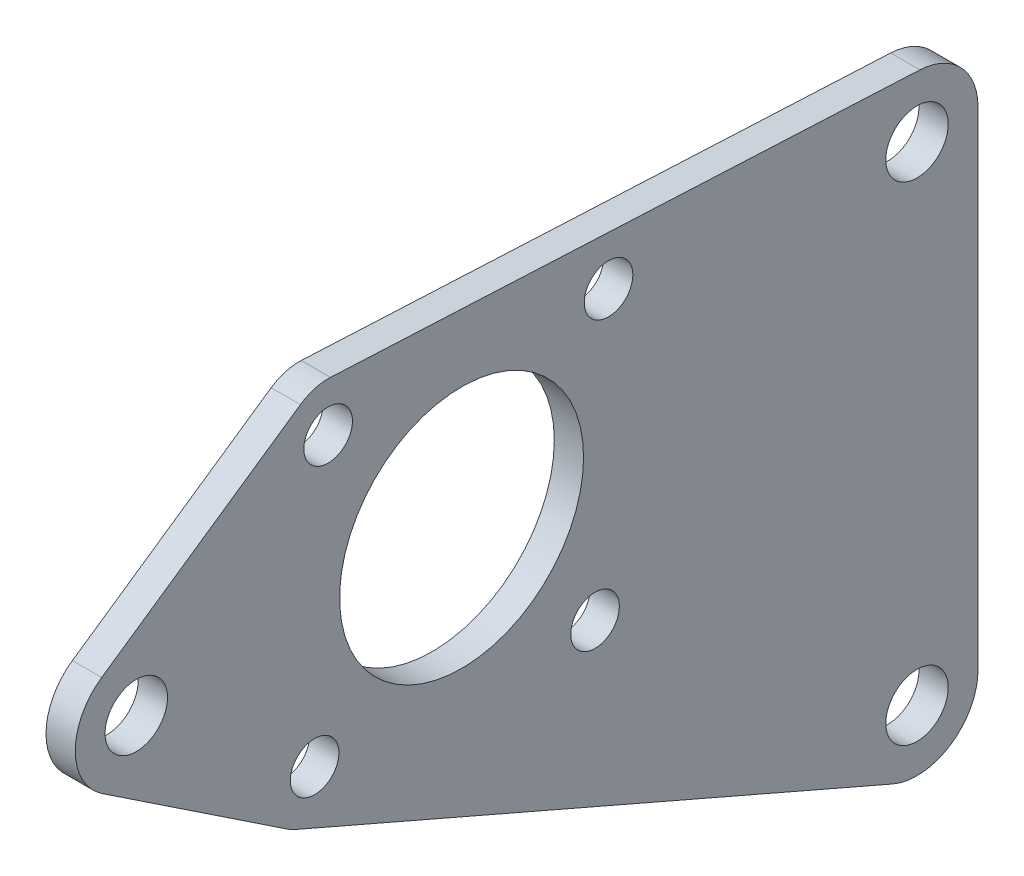
from build123d import *

# Parameters (mm, degrees)
SKETCH1_R             = 2.4384
SKETCH1_R_2           = 9.525
BASE_FLANGE1_DEPTH    = 2.286
F_6_CLEARANCE_HOLE1_D = 3.7973


# Sheet-metal steps are written as plain solids
with BuildPart() as part:
    # Sketch1 → Base-Flange1 (new body)
    with BuildSketch(Plane(origin=(0, 0, 0), x_dir=(0, 0, -1), z_dir=(1, 0, 0))):
        with BuildLine():
            Line((4.7625, 38.1), (4.7625, 0))
            ThreePointArc((4.7625, 0), (2.61262586, -3.981908131), (-1.896016479, -4.368813084))
            Line((-1.896016479, -4.368813084), (-48.551698058, 15.879235852))
            ThreePointArc((-48.551698058, 15.879235852), (-48.856590074, 16.028021212), (-49.147038032, 16.203338662))
            Line((-49.147038032, 16.203338662), (-63.600191446, 25.830515429))
            ThreePointArc((-63.600191446, 25.830515429), (-65.722355809, 29.757140553), (-63.661556753, 33.716316439))
            Line((-63.661556753, 33.716316439), (-48.141159083, 44.406778026))
            ThreePointArc((-48.141159083, 44.406778026), (-47.023714737, 44.933314584), (-45.796546729, 45.074669792))
            Line((-45.796546729, 45.074669792), (0.229208689, 42.856981146))
            ThreePointArc((0.229208689, 42.856981146), (3.447681296, 41.385559303), (4.7625, 38.1))
        make_face()
        with Locations((0, 38.1)):
            Circle(SKETCH1_R, mode=Mode.SUBTRACT)
        Circle(SKETCH1_R, mode=Mode.SUBTRACT)
        with Locations((-60.96, 29.7942)):
            Circle(SKETCH1_R, mode=Mode.SUBTRACT)
        with Locations((-35.56, 29.7942)):
            Circle(SKETCH1_R_2, mode=Mode.SUBTRACT)
    extrude(amount=-BASE_FLANGE1_DEPTH)

    # #6 Clearance Hole1 (through all)
    with Locations(Plane(origin=(0, 0, 0), x_dir=(0, 0, -1), z_dir=(1, 0, 0))):
        with Locations((-24.085115125, 40.214113681), (-45.979913681, 41.269084875), (-25.140086319, 18.319315125), (-47.034884875, 19.374286319)):
            Hole(F_6_CLEARANCE_HOLE1_D / 2)


solid = part.part
